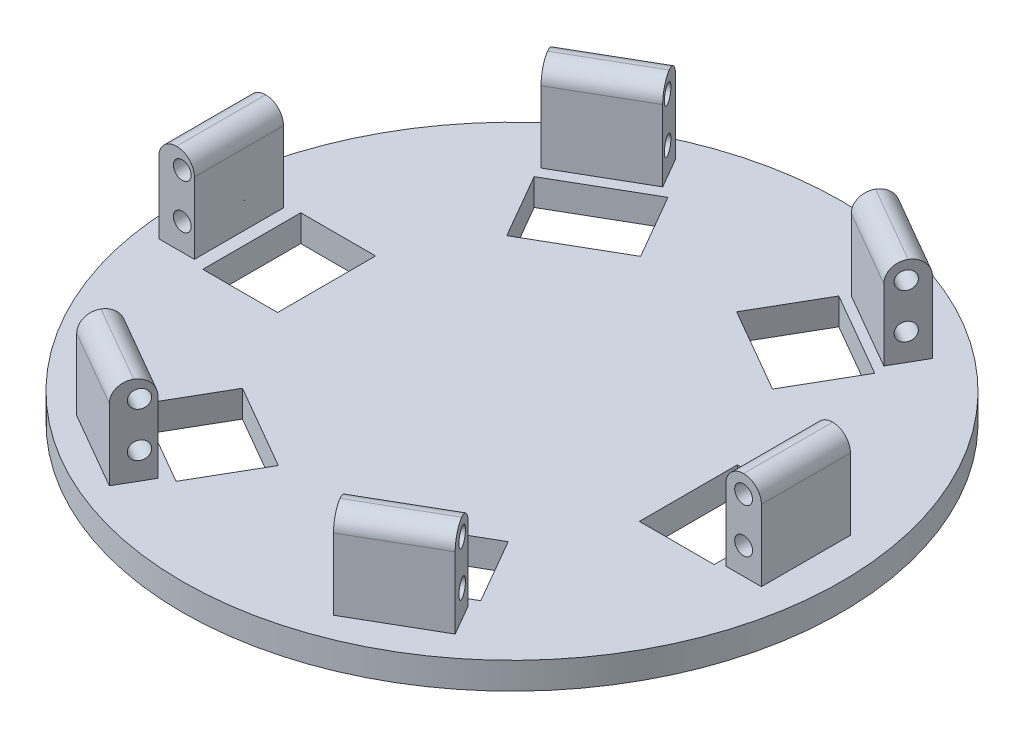
from build123d import *

# Parameters (mm, degrees)
SKETCH_6_W                     = 111
SKETCH_6_H                     = 9
SKETCH_7_W                     = 12
SKETCH_7_H                     = 30
EXTRUDE_5_DEPTH                = 30
SKETCH_8_R                     = 3
CUT_EXTRUDE_2_DEPTH            = 200.07204757
FILLET_2_R                     = 6
SKETCH_9_W                     = 25.2
SKETCH_9_H                     = 33
CUT_EXTRUDE_3_DEPTH            = 178.121180423
PATTERN_START                  = -15
PATTERN_CIRCULAR_3_OUTLINE_R   = 3
PATTERN_CIRCULAR_3_DEPTH       = 30
PATTERN_START_2                = -37.701760736
PATTERN_CIRCULAR_3_2_OUTLINE_R = 3
PATTERN_CIRCULAR_3_2_DEPTH     = 30
PATTERN_CIRCULAR_3_3_OUTLINE_R = 3
PATTERN_CIRCULAR_3_3_DEPTH     = 0.833530395
PATTERN_CIRCULAR_3_4_OUTLINE_R = 3
PATTERN_CIRCULAR_3_4_DEPTH     = 30
PATTERN_CIRCULAR_3_5_OUTLINE_R = 3
PATTERN_CIRCULAR_3_5_DEPTH     = 0.833530395
PATTERN_START_3                = -16.5
PATTERN_CIRCULAR_3_6_OUTLINE_W = 25.2
PATTERN_CIRCULAR_3_6_OUTLINE_H = 9
PATTERN_CIRCULAR_3_6_DEPTH     = 33
PATTERN_START_4                = -38.368230341
PATTERN_CIRCULAR_3_7_OUTLINE_W = 25.2
PATTERN_CIRCULAR_3_7_OUTLINE_H = 9
PATTERN_CIRCULAR_3_7_DEPTH     = 33
PATTERN_CIRCULAR_3_8_OUTLINE_W = 25.2
PATTERN_CIRCULAR_3_8_OUTLINE_H = 9
PATTERN_CIRCULAR_3_8_DEPTH     = 33


# Read off the part's stored shape, not the designer's step: 阵列(圆周)3
with BuildPart() as part:
    # 草图6 → 旋转3 (revolve)
    with BuildSketch(Plane.XY, mode=Mode.PRIVATE) as revolve_3_sk:
        with Locations((31.774677383, -70.351637053)):
            Rectangle(SKETCH_6_W, SKETCH_6_H)
    revolve(revolve_3_sk.sketch.rotate(Axis((-23.725322617, -65.851637053, 0), (0, -1, 0)), 90), axis=Axis((-23.725322617, -65.851637053, 0), (0, -1, 0)))

    # 草图7 → 凸台-拉伸5 (add)
    with BuildSketch(Plane(origin=(0, -65.851637053, 0), x_dir=(1, 0, 0), z_dir=(0, 1, 0))):
        with Locations((69.274677383, 0)):
            Rectangle(SKETCH_7_W, SKETCH_7_H)
    extrude(amount=EXTRUDE_5_DEPTH)

    # 草图8 → 切除-拉伸2 (cut, through all)
    with BuildSketch(Plane.XY.offset(15)):
        with Locations((69.274677383, -41.851637053)):
            Circle(SKETCH_8_R)
        with Locations((69.274677383, -56.851637053)):
            Circle(SKETCH_8_R)
    extrude(amount=-CUT_EXTRUDE_2_DEPTH, mode=Mode.SUBTRACT)

    # 圆角2
    fillet_2_edges = [part.edges().sort_by_distance(p)[0] for p in [
        (63.274677383, -35.851637053, 0),
        (75.274677383, -35.851637053, 0),
    ]]
    fillet(fillet_2_edges, radius=FILLET_2_R - 0.0001)  # a hair under: the kernel refuses the full size

    # 草图9 → 切除-拉伸3 (cut, through all)
    with BuildSketch(Plane(origin=(0, -65.851637053, 0), x_dir=(1, 0, 0), z_dir=(0, 1, 0))):
        with Locations((48.274677383, 0)):
            Rectangle(SKETCH_9_W, SKETCH_9_H)
    extrude(amount=-CUT_EXTRUDE_3_DEPTH, mode=Mode.SUBTRACT)

    # 阵列(圆周)3 outline → 阵列(圆周)3 (add)
    with BuildSketch(Plane.XY.offset(PATTERN_START)):
        with BuildLine():
            ThreePointArc((-121.702148071, -35.851637053), (-125.944788758, -37.608996366), (-127.702148071, -41.851637053))
            Line((-127.702148071, -41.851637053), (-127.702148071, -65.851637053))
            Line((-127.702148071, -65.851637053), (-115.702148071, -65.851637053))
            Line((-115.702148071, -65.851637053), (-115.702148071, -41.851637053))
            ThreePointArc((-115.702148071, -41.851637053), (-117.459507384, -37.608996366), (-121.702148071, -35.851637053))
        make_face()
        with Locations((-119.777192079, -56.851637053)):
            Circle(PATTERN_CIRCULAR_3_OUTLINE_R, mode=Mode.SUBTRACT)
        with Locations((-119.777192079, -41.851637053)):
            Circle(PATTERN_CIRCULAR_3_OUTLINE_R, mode=Mode.SUBTRACT)
    extrude(amount=PATTERN_CIRCULAR_3_DEPTH)

    # Pattern Circular 3 2 outline → Pattern Circular 3 2 (add)
    # profile 1 of 2: a face of its own
    with BuildSketch(Plane(origin=(0, 0, 0), x_dir=(0.49999999999999767, 0, -0.86602540378444), z_dir=(0.8660254037844399, 0, 0.49999999999999795)).offset(PATTERN_START_2)):
        with BuildLine():
            Line((76.381545055, -65.851637053), (88.381545055, -65.851637053))
            Line((88.381545055, -65.851637053), (88.381545055, -41.851637053))
            ThreePointArc((88.381545055, -41.851637053), (86.624185742, -37.608996366), (82.381545055, -35.851637053))
            ThreePointArc((82.381545055, -35.851637053), (78.138904368, -37.608996366), (76.381545055, -41.851637053))
            Line((76.381545055, -41.851637053), (76.381545055, -65.851637053))
        make_face()
        with Locations((81.900306057, -56.851637053)):
            Circle(PATTERN_CIRCULAR_3_2_OUTLINE_R, mode=Mode.SUBTRACT)
        with Locations((81.900306057, -41.851637053)):
            Circle(PATTERN_CIRCULAR_3_2_OUTLINE_R, mode=Mode.SUBTRACT)
    # profile 2 of 2: a face of its own
    with BuildSketch(Plane(origin=(0, 0, 0), x_dir=(0.49999999999999767, 0, -0.86602540378444), z_dir=(0.8660254037844399, 0, 0.49999999999999795)).offset(PATTERN_START_2)):
        with BuildLine():
            Line((-114.595280399, -65.851637053), (-102.595280399, -65.851637053))
            Line((-102.595280399, -65.851637053), (-102.595280399, -41.851637053))
            ThreePointArc((-102.595280399, -41.851637053), (-104.352639712, -37.608996366), (-108.595280399, -35.851637053))
            ThreePointArc((-108.595280399, -35.851637053), (-112.837921086, -37.608996366), (-114.595280399, -41.851637053))
            Line((-114.595280399, -41.851637053), (-114.595280399, -65.851637053))
        make_face()
        with Locations((-107.151563405, -56.851637053)):
            Circle(PATTERN_CIRCULAR_3_2_OUTLINE_R, mode=Mode.SUBTRACT)
        with Locations((-107.151563405, -41.851637053)):
            Circle(PATTERN_CIRCULAR_3_2_OUTLINE_R, mode=Mode.SUBTRACT)
    extrude(amount=PATTERN_CIRCULAR_3_2_DEPTH)

    # Pattern Circular 3 3 outline → Pattern Circular 3 3 (add)
    with BuildSketch(Plane(origin=(0, 0, 0), x_dir=(0.49999999999999767, 0, -0.86602540378444), z_dir=(0.8660254037844399, 0, 0.49999999999999795)).offset(PATTERN_START_2)):
        with Locations((-107.151563405, -56.851637053)):
            Circle(PATTERN_CIRCULAR_3_3_OUTLINE_R)
        with Locations((-107.151563405, -41.851637053)):
            Circle(PATTERN_CIRCULAR_3_3_OUTLINE_R)
    extrude(amount=PATTERN_CIRCULAR_3_3_DEPTH)

    # Pattern Circular 3 4 outline → Pattern Circular 3 4 (add)
    # profile 1 of 2: a face of its own
    with BuildSketch(Plane(origin=(0, 0, 0), x_dir=(0.500000000000004, 0, 0.8660254037844363), z_dir=(0.8660254037844363, 0, -0.5000000000000042)).offset(PATTERN_START_2)):
        with BuildLine():
            Line((-102.595280399, 65.851637053), (-114.595280399, 65.851637053))
            Line((-114.595280399, 65.851637053), (-114.595280399, 41.851637053))
            ThreePointArc((-114.595280399, 41.851637053), (-112.837921086, 37.608996366), (-108.595280399, 35.851637053))
            ThreePointArc((-108.595280399, 35.851637053), (-104.352639712, 37.608996366), (-102.595280399, 41.851637053))
            Line((-102.595280399, 41.851637053), (-102.595280399, 65.851637053))
        make_face()
        with Locations((-107.151563405, 41.851637053)):
            Circle(PATTERN_CIRCULAR_3_4_OUTLINE_R, mode=Mode.SUBTRACT)
        with Locations((-107.151563405, 56.851637053)):
            Circle(PATTERN_CIRCULAR_3_4_OUTLINE_R, mode=Mode.SUBTRACT)
    # profile 2 of 2: a face of its own
    with BuildSketch(Plane(origin=(0, 0, 0), x_dir=(0.500000000000004, 0, 0.8660254037844363), z_dir=(0.8660254037844363, 0, -0.5000000000000042)).offset(PATTERN_START_2)):
        with BuildLine():
            Line((88.381545055, 65.851637053), (76.381545055, 65.851637053))
            Line((76.381545055, 65.851637053), (76.381545055, 41.851637053))
            ThreePointArc((76.381545055, 41.851637053), (78.138904368, 37.608996366), (82.381545055, 35.851637053))
            ThreePointArc((82.381545055, 35.851637053), (86.624185742, 37.608996366), (88.381545055, 41.851637053))
            Line((88.381545055, 41.851637053), (88.381545055, 65.851637053))
        make_face()
        with Locations((81.900306057, 41.851637053)):
            Circle(PATTERN_CIRCULAR_3_4_OUTLINE_R, mode=Mode.SUBTRACT)
        with Locations((81.900306057, 56.851637053)):
            Circle(PATTERN_CIRCULAR_3_4_OUTLINE_R, mode=Mode.SUBTRACT)
    extrude(amount=PATTERN_CIRCULAR_3_4_DEPTH)

    # Pattern Circular 3 5 outline → Pattern Circular 3 5 (add)
    with BuildSketch(Plane(origin=(0, 0, 0), x_dir=(0.500000000000004, 0, 0.8660254037844363), z_dir=(0.8660254037844363, 0, -0.5000000000000042)).offset(PATTERN_START_2)):
        with Locations((81.900306057, 56.851637053)):
            Circle(PATTERN_CIRCULAR_3_5_OUTLINE_R)
        with Locations((81.900306057, 41.851637053)):
            Circle(PATTERN_CIRCULAR_3_5_OUTLINE_R)
    extrude(amount=PATTERN_CIRCULAR_3_5_DEPTH)

    # Pattern Circular 3 6 outline → Pattern Circular 3 6 (cut)
    with BuildSketch(Plane.XY.offset(PATTERN_START_3)):
        with Locations((-98.777192079, -70.351637053)):
            Rectangle(PATTERN_CIRCULAR_3_6_OUTLINE_W, PATTERN_CIRCULAR_3_6_OUTLINE_H)
    extrude(amount=PATTERN_CIRCULAR_3_6_DEPTH, mode=Mode.SUBTRACT)

    # Pattern Circular 3 7 outline → Pattern Circular 3 7 (cut)
    with BuildSketch(Plane(origin=(0, 0, 0), x_dir=(0.49999999999999767, 0, -0.86602540378444), z_dir=(0.8660254037844399, 0, 0.49999999999999795)).offset(PATTERN_START_4)):
        with Locations((60.900306057, -70.351637053)):
            Rectangle(PATTERN_CIRCULAR_3_7_OUTLINE_W, PATTERN_CIRCULAR_3_7_OUTLINE_H)
        with Locations((-86.151563405, -70.351637053)):
            Rectangle(PATTERN_CIRCULAR_3_7_OUTLINE_W, PATTERN_CIRCULAR_3_7_OUTLINE_H)
    extrude(amount=PATTERN_CIRCULAR_3_7_DEPTH, mode=Mode.SUBTRACT)

    # Pattern Circular 3 8 outline → Pattern Circular 3 8 (cut)
    with BuildSketch(Plane(origin=(0, 0, 0), x_dir=(0.500000000000004, 0, 0.8660254037844363), z_dir=(0.8660254037844363, 0, -0.5000000000000042)).offset(PATTERN_START_4)):
        with Locations((-86.151563405, 70.351637053)):
            Rectangle(PATTERN_CIRCULAR_3_8_OUTLINE_W, PATTERN_CIRCULAR_3_8_OUTLINE_H)
        with Locations((60.900306057, 70.351637053)):
            Rectangle(PATTERN_CIRCULAR_3_8_OUTLINE_W, PATTERN_CIRCULAR_3_8_OUTLINE_H)
    extrude(amount=PATTERN_CIRCULAR_3_8_DEPTH, mode=Mode.SUBTRACT)


solid = part.part
